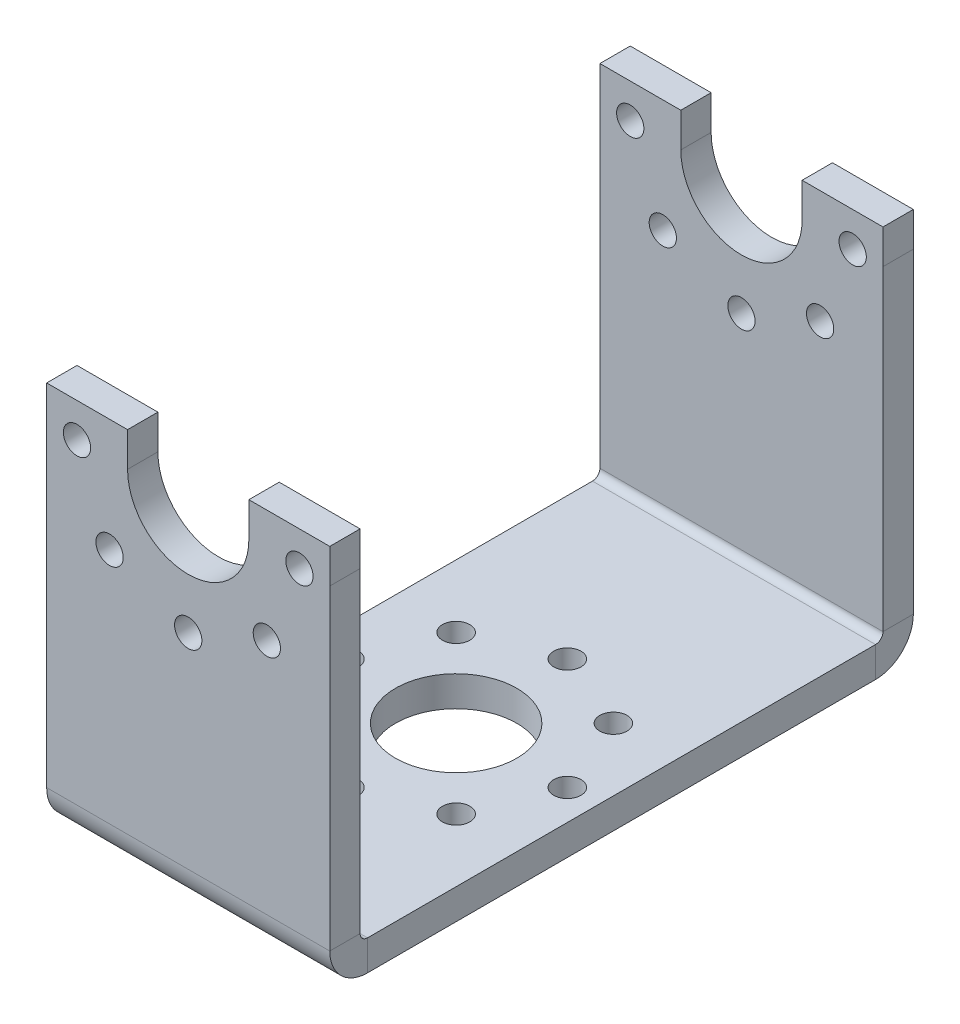
from build123d import *

# Parameters (mm, degrees)
SKETCH_1_W             = 28
SKETCH_1_H             = 160
SKETCH_1_R             = 6
SKETCH_1_R_2           = 1.35
SM_BASE_FLANGE_1_DEPTH = 3
OTHER_START            = -14
OTHER_1_DEPTH          = 28
OTHER_1_2_DEPTH        = 28
SKETCH_7_R             = 1.35
CUT_EXTRUDE_1_DEPTH    = 81.582164958


# Read off the part's stored shape, not the designer's step: 绘制的折弯1
# Sheet-metal steps are written as plain solids
with BuildPart() as part:
    # Sketch 1 → 基体-法兰1 (new body)
    with BuildSketch(Plane(origin=(0, 0, 0), x_dir=(1, 0, 0), z_dir=(0, 1, 0))):
        Rectangle(SKETCH_1_W, SKETCH_1_H)
        with Locations(Location((0, 0, 0), (0, 0, 270))):
            Circle(SKETCH_1_R, mode=Mode.SUBTRACT)
        with Locations(Location((0, 11, 0), (0, 0, 270))):
            Circle(SKETCH_1_R_2, mode=Mode.SUBTRACT)
        with Locations(Location((7.778174593, 7.778174593, 0), (0, 0, 270))):
            Circle(SKETCH_1_R_2, mode=Mode.SUBTRACT)
        with Locations(Location((11, 0, 0), (0, 0, 270))):
            Circle(SKETCH_1_R_2, mode=Mode.SUBTRACT)
        with Locations(Location((7.778174593, -7.778174593, 0), (0, 0, 270))):
            Circle(SKETCH_1_R_2, mode=Mode.SUBTRACT)
        with Locations(Location((0, -11, 0), (0, 0, 270))):
            Circle(SKETCH_1_R_2, mode=Mode.SUBTRACT)
        with Locations(Location((-7.778174593, -7.778174593, 0), (0, 0, 270))):
            Circle(SKETCH_1_R_2, mode=Mode.SUBTRACT)
        with Locations(Location((-11, 0, 0), (0, 0, 270))):
            Circle(SKETCH_1_R_2, mode=Mode.SUBTRACT)
        with Locations(Location((-7.778174593, 7.778174593, 0), (0, 0, 270))):
            Circle(SKETCH_1_R_2, mode=Mode.SUBTRACT)
    extrude(amount=-SM_BASE_FLANGE_1_DEPTH)

    # Other 1 outline → Other 1 (cut)
    with BuildSketch(Plane.YZ.offset(OTHER_START)):
        with BuildLine():
            ThreePointArc((0, -31.146677222), (-2.154295979, -29.850867001), (-3, -27.4834))
            Line((-3, -27.4834), (-3, -80))
            Line((-3, -80), (0, -80))
            Line((0, -80), (0, -31.146677222))
        make_face()
        with BuildLine():
            Line((-3, 80), (-3, 22.7634))
            ThreePointArc((-3, 22.7634), (-2.154295979, 25.130867001), (0, 26.426677222))
            Line((0, 26.426677222), (0, 80))
            Line((0, 80), (-3, 80))
        make_face()
    extrude(amount=OTHER_1_DEPTH, mode=Mode.SUBTRACT)

    # Other 1 2 outline → Other 1 2 (add)
    with BuildSketch(Plane.YZ.offset(OTHER_START)):
        with BuildLine():
            Line((0, -27.4834), (0, -31.146677222))
            ThreePointArc((0, -31.146677222), (0.36647982, -31.201624121), (0.7366, -31.22))
            Line((0.7366, -31.22), (49.739956935, -31.22))
            Line((49.739956935, -31.22), (49.739956935, -28.22))
            Line((49.739956935, -28.22), (0.7366, -28.22))
            ThreePointArc((0.7366, -28.22), (0.215745145, -28.004254855), (0, -27.4834))
        make_face()
        with BuildLine():
            ThreePointArc((0.7366, 26.5), (0.36647982, 26.481624121), (0, 26.426677222))
            Line((0, 26.426677222), (0, 22.7634))
            ThreePointArc((0, 22.7634), (0.215745145, 23.284254855), (0.7366, 23.5))
            Line((0.7366, 23.5), (54.459956935, 23.5))
            Line((54.459956935, 23.5), (54.459956935, 26.5))
            Line((54.459956935, 26.5), (0.7366, 26.5))
        make_face()
    extrude(amount=OTHER_1_2_DEPTH)

    # 草图7 → 切除-拉伸1 (cut, through all)
    with BuildSketch(Plane(origin=(0, 0, -31.22), x_dir=(-1, 0, 0), z_dir=(0, 0, -1))):
        with Locations(Location((11, 32, 0), (0, 0, 90))):
            Circle(SKETCH_7_R)
        with Locations(Location((7.778174593, 24.221825407, 0), (0, 0, 90))):
            Circle(SKETCH_7_R)
        with Locations(Location((0, 21, 0), (0, 0, 90))):
            Circle(SKETCH_7_R)
        with Locations(Location((-7.778174593, 24.221825407, 0), (0, 0, 90))):
            Circle(SKETCH_7_R)
        with Locations(Location((-11, 32, 0), (0, 0, 90))):
            Circle(SKETCH_7_R)
        with BuildLine():
            Line((-14, 32), (-32.703539992, 32))
            Line((-32.703539992, 32), (-28.620805063, 56.964772816))
            Line((-28.620805063, 56.964772816), (24.538070134, 56.964772816))
            Line((24.538070134, 56.964772816), (24.538070134, 32))
            Line((24.538070134, 32), (14, 32))
            Line((14, 32), (14, 35.400052641))
            Line((14, 35.400052641), (6, 35.400052641))
            Line((6, 35.400052641), (6, 32))
            ThreePointArc((6, 32), (0, 26), (-6, 32))
            Line((-6, 32), (-6, 35.400052641))
            Line((-6, 35.400052641), (-14, 35.400052641))
            Line((-14, 35.400052641), (-14, 32))
        make_face()
    extrude(amount=-CUT_EXTRUDE_1_DEPTH, mode=Mode.SUBTRACT)


solid = part.part
